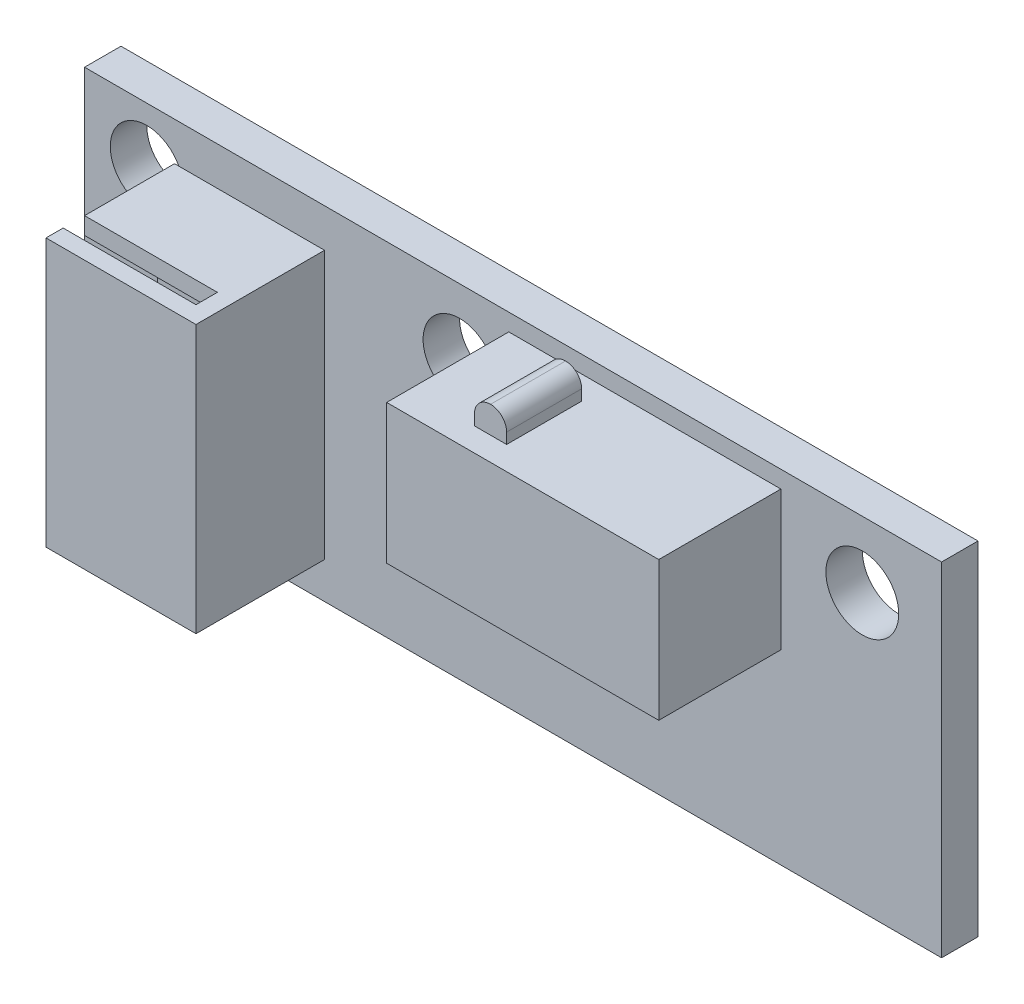
from build123d import *

# Parameters (mm, degrees)
SKETCH1_W            = 40
SKETCH1_H            = 16
BOSS_EXTRUDE1_DEPTH  = 1.7
M3_CLEARANCE_HOLE1_D = 3.4
SKETCH5_W            = 12.7
SKETCH5_H            = 6.5
BOSS_EXTRUDE2_DEPTH  = 5.7
SKETCH6_W            = 1.5
SKETCH6_H            = 3.5
BOSS_EXTRUDE3_DEPTH  = 1.25
FILLET1_R            = 0.75
SKETCH7_W            = 7
SKETCH7_H            = 12.5
BOSS_EXTRUDE4_DEPTH  = 6
CUT_EXTRUDE1_DEPTH   = 6.2


with BuildPart() as part:
    # Sketch1 → Boss-Extrude1 (new body)
    with BuildSketch(Plane.XY):
        Rectangle(SKETCH1_W, SKETCH1_H)
    extrude(amount=BOSS_EXTRUDE1_DEPTH)

    # M3 Clearance Hole1 (through all)
    with Locations(Plane.XY.offset(1.7)):
        with Locations((-17.1, -5.4), (-2.5, 4.9), (16.3, 4.9), (-17.1, 5.4)):
            Hole(M3_CLEARANCE_HOLE1_D / 2)

    # Sketch5 → Boss-Extrude2 (add)
    with BuildSketch(Plane.XY.offset(1.7)):
        with Locations((6.15, 3.95)):
            Rectangle(SKETCH5_W, SKETCH5_H)
    extrude(amount=BOSS_EXTRUDE2_DEPTH)


with BuildPart() as body_2:
    # Sketch6 → Boss-Extrude3 (new body)
    with BuildSketch(Plane(origin=(0, 7.2, 0), x_dir=(1, 0, 0), z_dir=(0, 1, 0))):
        with Locations((3.55, -4.55)):
            Rectangle(SKETCH6_W, SKETCH6_H)
    extrude(amount=BOSS_EXTRUDE3_DEPTH)

    # Fillet1
    fillet1_edges = [body_2.edges().sort_by_distance(p)[0] for p in [
        (4.3, 8.45, 4.55),
        (2.8, 8.45, 4.55),
    ]]
    fillet(fillet1_edges, radius=FILLET1_R - 0.0001)  # a hair under: the kernel refuses the full size


with BuildPart() as body_3:
    # Sketch7 → Boss-Extrude4 (new body)
    with BuildSketch(Plane.XY.offset(1.7)):
        with Locations((-12.3, -0.05)):
            Rectangle(SKETCH7_W, SKETCH7_H)
    extrude(amount=BOSS_EXTRUDE4_DEPTH)

    # Sketch8 → Cut-Extrude1 (cut)
    with BuildSketch(Plane.ZY.offset(15.8)):
        Polygon((6.9, 6.2), (5.9, 6.2), (5.9, 5.4), (2.5, 5.4), (2.5, -5.5), (5.9, -5.5), (5.9, -6.3), (6.9, -6.3), align=None)
    extrude(amount=-CUT_EXTRUDE1_DEPTH, mode=Mode.SUBTRACT)


solid = Compound([part.part, body_2.part, body_3.part])
